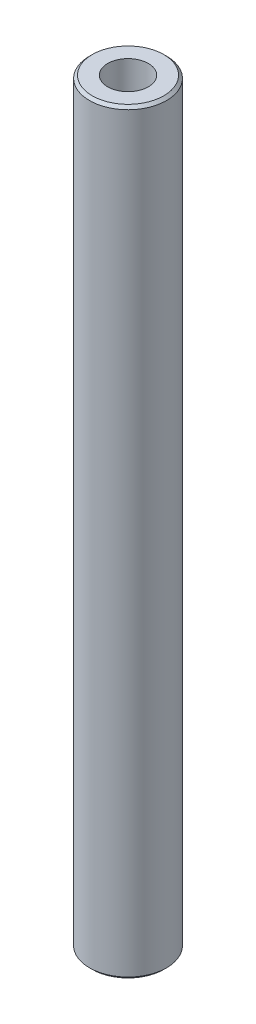
from build123d import *

# Parameters (mm, degrees)
SKETCH1_R           = 5
BOSS_EXTRUDE1_DEPTH = 98.232856947
SKETCH2_R           = 2.636133781
CUT_EXTRUDE1_DEPTH  = 99.48702546
CHAMFER1_SIZE       = 0.357941076


with BuildPart() as part:
    # Sketch1 → Boss-Extrude1 (new body)
    with BuildSketch(Plane(origin=(0, 0, 0), x_dir=(1, 0, 0), z_dir=(0, 1, 0))):
        Circle(SKETCH1_R)
    extrude(amount=BOSS_EXTRUDE1_DEPTH)

    # Sketch2 → Cut-Extrude1 (cut, through all)
    with BuildSketch(Plane(origin=(0, 0, 0), x_dir=(1, 0, 0), z_dir=(0, 1, 0))):
        Circle(SKETCH2_R)
    extrude(amount=CUT_EXTRUDE1_DEPTH, mode=Mode.SUBTRACT)

    # Chamfer1
    chamfer1_edges = [part.edges().sort_by_distance(p)[0] for p in [
        (-5, 98.232856947, 0),
        (-5, 0, 0),
    ]]
    chamfer(chamfer1_edges, length=CHAMFER1_SIZE)


solid = part.part
